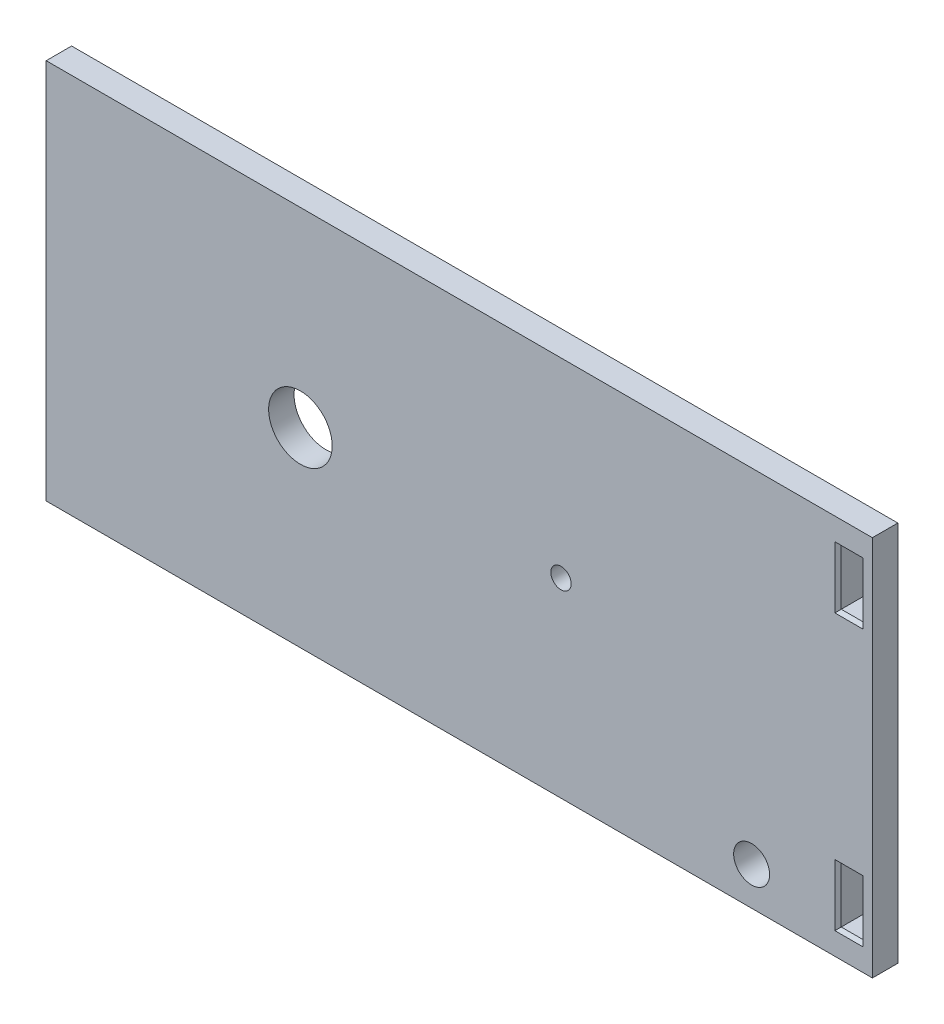
from build123d import *

# Parameters (mm, degrees)
SKETCH1_W           = 130
SKETCH1_H           = 60
SKETCH1_R           = 5
SKETCH1_R_2         = 2.83
SKETCH1_R_3         = 1.6
SKETCH1_W_2         = 3.4
SKETCH1_H_2         = 8.7
BOSS_EXTRUDE1_DEPTH = 2
CHAMFER1_SIZE       = 0.5


with BuildPart() as part:
    # Sketch1 → Boss-Extrude1 (new, symmetric)
    with BuildSketch(Plane.XY):
        Rectangle(SKETCH1_W, SKETCH1_H)
        with Locations((-25, 0)):
            Circle(SKETCH1_R, mode=Mode.SUBTRACT)
        with Locations((46, -24)):
            Circle(SKETCH1_R_2, mode=Mode.SUBTRACT)
        with Locations((16, 0)):
            Circle(SKETCH1_R_3, mode=Mode.SUBTRACT)
        with Locations((61.3, 21.65)):
            Rectangle(SKETCH1_W_2, SKETCH1_H_2, mode=Mode.SUBTRACT)
        with Locations((61.3, -21.65)):
            Rectangle(SKETCH1_W_2, SKETCH1_H_2, mode=Mode.SUBTRACT)
    extrude(amount=BOSS_EXTRUDE1_DEPTH, both=True)

    # Chamfer1
    chamfer1_edges = [part.edges().sort_by_distance(p)[0] for p in [
        (61.3, 17.3, 2),
        (59.6, 21.65, 2),
        (61.3, 26, 2),
        (63, 21.65, 2),
        (61.3, -26, 2),
        (59.6, -21.65, 2),
        (61.3, -17.3, 2),
        (63, -21.65, 2),
    ]]
    chamfer(chamfer1_edges, length=CHAMFER1_SIZE)


solid = part.part
